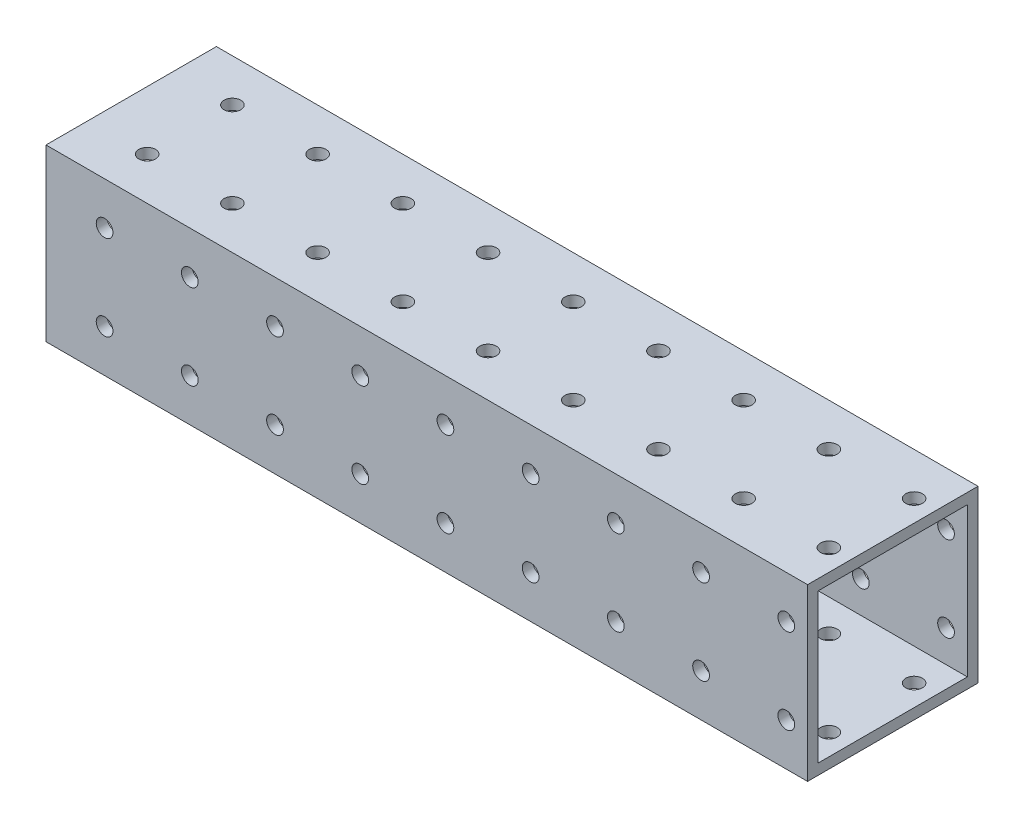
from build123d import *

# Parameters (mm, degrees)
SKETCH1_W           = 50.8
SKETCH1_H           = 50.8
BOSS_EXTRUDE1_DEPTH = 227.0125
SHELL1_T            = -3.175
SKETCH2_R           = 2.4892
CUT_EXTRUDE3_DEPTH  = 239.109124471
SKETCH3_R           = 2.4892
CUT_EXTRUDE2_DEPTH  = 239.109124471
LPATTERN1_COUNT     = 9
LPATTERN1_PITCH     = 25.4


with BuildPart() as part:
    # Sketch1 → Boss-Extrude1 (new body)
    with BuildSketch(Plane(origin=(0, 0, 0), x_dir=(0, 0, -1), z_dir=(1, 0, 0))):
        with Locations((25.4, 25.4)):
            Rectangle(SKETCH1_W, SKETCH1_H)
    extrude(amount=BOSS_EXTRUDE1_DEPTH)

    # Shell1
    shell1_openings = [part.faces().sort_by_distance(p)[0] for p in [
        (0, 25.4, -25.4),
        (227.0125, 25.4, -25.4),
    ]]
    offset(amount=SHELL1_T, openings=shell1_openings, kind=Kind.INTERSECTION)

    # Sketch2 → Cut-Extrude3 (cut, through all)
    with BuildSketch(Plane(origin=(0, 0, -50.8), x_dir=(-1, 0, 0), z_dir=(0, 0, -1))):
        with Locations((-220.6625, 38.1)):
            Circle(SKETCH2_R)
        with Locations((-220.6625, 12.7)):
            Circle(SKETCH2_R)
    cut_extrude3 = extrude(amount=-CUT_EXTRUDE3_DEPTH, mode=Mode.SUBTRACT)

    # Sketch3 → Cut-Extrude2 (cut, through all)
    with BuildSketch(Plane.XZ):
        with Locations((220.6625, -12.7)):
            Circle(SKETCH3_R)
        with Locations((220.6625, -38.1)):
            Circle(SKETCH3_R)
    cut_extrude2 = extrude(amount=-CUT_EXTRUDE2_DEPTH, mode=Mode.SUBTRACT)

    # LPattern1: Cut-Extrude3, Cut-Extrude2 ×9
    with Locations(*[(-i * LPATTERN1_PITCH, 0, 0) for i in range(1, LPATTERN1_COUNT)]):
        add(cut_extrude3, mode=Mode.SUBTRACT)
        add(cut_extrude2, mode=Mode.SUBTRACT)


solid = part.part
